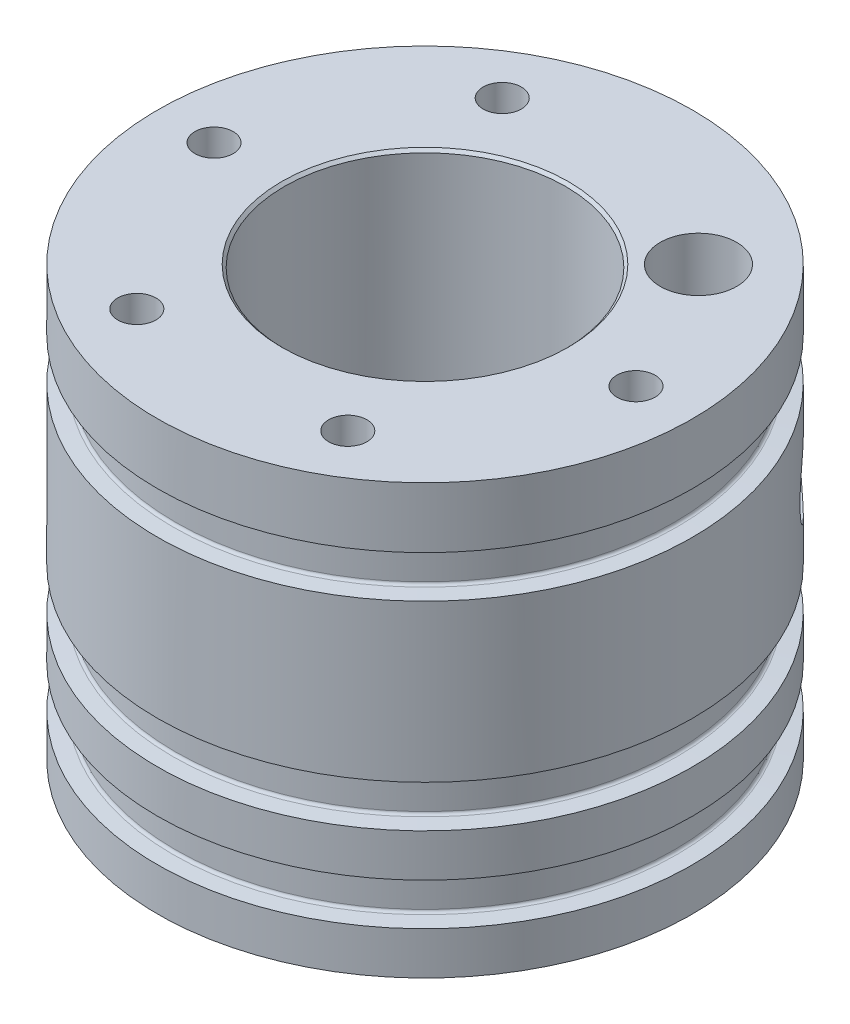
from build123d import *

# Parameters (mm, degrees)
CIRPATTERN1_COUNT            = 6
CUT_EXTRUDE1_REACH           = 72.009
CUT_EXTRUDE1_END_RADIUS      = 12.7
SKETCH15_R                   = 3.175
F_5_16_24_TAPPED_HOLE1_D     = 6.9088
F_5_16_24_TAPPED_HOLE1_DEPTH = 16.509
F_5_16_24_TAPPED_HOLE1_TIP   = 2.075612922
CHAMFER1_SIZE                = 0.254


with BuildPart() as part:
    # Sketch1 → Revolve1 (revolve)
    with BuildSketch(Plane.XY):
        Polygon((6.8961, 0), (6.8961, 3.81), (12.7, 12.098828216), (12.7, 38.735), (24.1554, 38.735), (24.1554, 0), align=None)
    revolve(axis=Axis((0, 0, 0), (0, 1, 0)))

    # Sketch6 → Groove for AS 568-132, O-Ring2 (revolve, cut)
    with BuildSketch(Plane(origin=(0, 0, 0), x_dir=(0, 0, -1), z_dir=(-1, 0, 0))):
        with BuildLine():
            Line((22.774362441, -3.977491583), (24.6888, -3.81))
            Line((24.6888, -3.81), (24.6888, -7.700983167))
            Line((24.6888, -7.700983167), (22.774362441, -7.533491583))
            ThreePointArc((22.774362441, -7.533491583), (22.609231556, -7.452058043), (22.5425, -7.28045813))
            Line((22.5425, -7.28045813), (22.5425, -4.230525037))
            ThreePointArc((22.5425, -4.230525037), (22.609231556, -4.058925124), (22.774362441, -3.977491583))
        make_face()
    revolve(axis=Axis((0, -50, 0), (0, 1, 0)), mode=Mode.SUBTRACT)

    # Sketch4 → Groove for AS 568-132, O-Ring1 (revolve, cut)
    with BuildSketch(Plane(origin=(0, 0, 0), x_dir=(0, 0, -1), z_dir=(-1, 0, 0))):
        with BuildLine():
            Line((22.774362441, -11.631808297), (24.6888, -11.464316714))
            Line((24.6888, -11.464316714), (24.6888, -15.355299881))
            Line((24.6888, -15.355299881), (22.774362441, -15.187808297))
            ThreePointArc((22.774362441, -15.187808297), (22.609231556, -15.106374757), (22.5425, -14.934774844))
            Line((22.5425, -14.934774844), (22.5425, -11.88484175))
            ThreePointArc((22.5425, -11.88484175), (22.609231556, -11.713241838), (22.774362441, -11.631808297))
        make_face()
    revolve(axis=Axis((0, -50, 0), (0, 1, 0)), mode=Mode.SUBTRACT)

    # Sketch9 → #8-32 Tapped Hole1 (revolve, cut)
    with BuildSketch(Plane(origin=(19.05, 38.735, 0), x_dir=(0, 0, 1), z_dir=(1, 0, 0))):
        Polygon((0, 0), (0, 10.562806461), (1.7272, 9.525), (1.7272, 0), align=None)
    f_8_32_tapped_hole1 = revolve(axis=Axis((19.05, 45.085, 0), (0, -1, 0)), mode=Mode.SUBTRACT)

    # CirPattern1: #8-32 Tapped Hole1 ×6 about axis, 1 skipped
    cirpattern1_axis = Axis((0, 0, 0), (0, -1, 0))
    add([f_8_32_tapped_hole1.rotate(cirpattern1_axis, i * 360 / CIRPATTERN1_COUNT) for i in range(1, CIRPATTERN1_COUNT) if i not in (5,)], mode=Mode.SUBTRACT)

    # Sketch11 → Groove for AS 568-132, O-Ring3 (revolve, cut)
    with BuildSketch(Plane(origin=(0, 0, 0), x_dir=(0, 0, -1), z_dir=(-1, 0, 0))):
        with BuildLine():
            Line((22.774362441, -29.592156785), (24.6888, -29.424665202))
            Line((24.6888, -29.424665202), (24.6888, -33.315648369))
            Line((24.6888, -33.315648369), (22.774362441, -33.148156785))
            ThreePointArc((22.774362441, -33.148156785), (22.609231556, -33.066723245), (22.5425, -32.895123332))
            Line((22.5425, -32.895123332), (22.5425, -29.845190239))
            ThreePointArc((22.5425, -29.845190239), (22.609231556, -29.673590326), (22.774362441, -29.592156785))
        make_face()
    revolve(axis=Axis((0, -50, 0), (0, 1, 0)), mode=Mode.SUBTRACT)

    # Cut-Extrude1: up to this cylinder (the profile starts outside it)
    cut_extrude1_end = Plane(origin=(0, 22.225, 0), z_dir=(0, -1, 0)) * Cylinder(CUT_EXTRUDE1_END_RADIUS, 170.418, mode=Mode.PRIVATE)
    # Sketch15 → Cut-Extrude1 (cut, up to the surface)
    with BuildSketch(Plane(origin=(17.080447142, 0, -17.080447142), x_dir=(0, -1, 0), z_dir=(0.7071067811865488, 0, -0.7071067811865464)), mode=Mode.PRIVATE) as cut_extrude1_sk1:
        with Locations((-22.225, 0)):
            Circle(SKETCH15_R)
    cut_extrude1_tool1 = extrude(cut_extrude1_sk1.sketch, amount=-CUT_EXTRUDE1_REACH, mode=Mode.PRIVATE) - cut_extrude1_end
    add(cut_extrude1_tool1.solids().sort_by_distance((17.080447, 22.225, -17.080447))[0], mode=Mode.SUBTRACT)

    # 5/16-24 Tapped Hole1
    with Locations(Plane(origin=(0, 38.735, 0), x_dir=(1, 0, 0), z_dir=(0, 1, 0))):
        with Locations((12.347852166, 12.347852166)):
            Hole(F_5_16_24_TAPPED_HOLE1_D / 2, depth=F_5_16_24_TAPPED_HOLE1_DEPTH)
            with Locations((0, 0, -(F_5_16_24_TAPPED_HOLE1_DEPTH + F_5_16_24_TAPPED_HOLE1_TIP / 2))):  # 118° drill point
                Cone(0, F_5_16_24_TAPPED_HOLE1_D / 2, F_5_16_24_TAPPED_HOLE1_TIP, mode=Mode.SUBTRACT)

    # Chamfer1
    chamfer1_edges = [part.edges().sort_by_distance(p)[0] for p in [
        (-12.7, 38.735, 0),
    ]]
    chamfer(chamfer1_edges, length=CHAMFER1_SIZE)


solid = part.part
